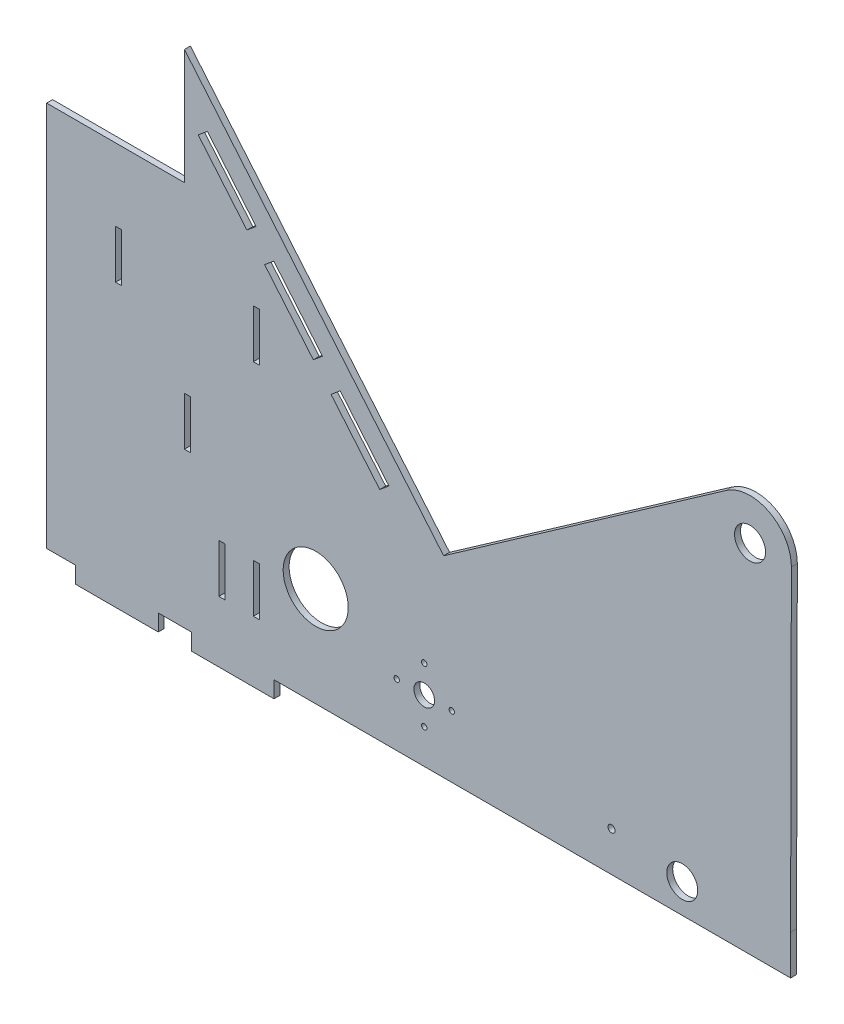
from build123d import *

# Parameters (mm, degrees)
SALIENTE_EXTRUIR1_DEPTH        = 5.5
SALIENTE_EXTRUIR2_START        = 11
SALIENTE_EXTRUIR2_DEPTH        = 5.5
CROQUIS25_R                    = 28.575
CROQUIS25_R_2                  = 14.2875
SALIENTE_EXTRUIR3_DEPTH        = 5.5
SALIENTE_EXTRUIR4_START        = 19.9
SALIENTE_EXTRUIR4_OUTLINE_R    = 2.4892
SALIENTE_EXTRUIR4_OUTLINE_R_2  = 9.525
SALIENTE_EXTRUIR4_OUTLINE_R_3  = 14.2875
SALIENTE_EXTRUIR4_DEPTH        = 5.5
CROQUIS27_R                    = 14.2875
SALIENTE_EXTRUIR6_DEPTH        = 5.5
SALIENTE_EXTRUIR6_2_DEPTH      = 5.5
CROQUIS28_W                    = 5.5
CROQUIS28_H                    = 31.75
CROQUIS28_R                    = 3.2639
CORTAR_EXTRUIR1_DEPTH          = 734.427120494
CORTAR_EXTRUIR2_START          = -25.4
CROQUIS29_W                    = 5.5
CROQUIS29_H                    = 31.75
CROQUIS29_W_2                  = 31.75
CROQUIS29_H_2                  = 5.5
CORTAR_EXTRUIR2_DEPTH          = 25.4
CROQUIS28_3_W                  = 5.5
CROQUIS28_3_H                  = 31.75
SALIENTE_EXTRUIR7_DEPTH        = 5.5
SALIENTE_EXTRUIR8_START        = -5.5
CROQUIS28_4_W                  = 5.5
CROQUIS28_4_H                  = 9.525
CROQUIS28_4_H_2                = 31.75
SALIENTE_EXTRUIR8_DEPTH        = 14.4
SALIENTE_EXTRUIR9_START        = -19.9
CROQUIS28_6_W                  = 5.5
CROQUIS28_6_H                  = 31.75
SALIENTE_EXTRUIR9_DEPTH        = 82.5
SALIENTE_EXTRUIR11_START       = -5.5
CROQUIS29_4_W                  = 5.5
CROQUIS29_4_H                  = 9.525
CROQUIS29_4_H_2                = 31.75
SALIENTE_EXTRUIR11_DEPTH       = 14.4
CROQUIS29_3_W                  = 5.5
CROQUIS29_3_H                  = 31.75
SALIENTE_EXTRUIR10_DEPTH       = 5.5
SALIENTE_EXTRUIR12_START       = -19.9
CROQUIS29_5_W                  = 5.5
CROQUIS29_5_H                  = 31.75
SALIENTE_EXTRUIR12_DEPTH       = 5.5
REDONDEO3_R                    = 6.35
REDONDEO2_R                    = 6.35
REDONDEO1_R                    = 2.54
CROQUIS30_R                    = 3.2639
CROQUIS30_W                    = 5.5
CROQUIS30_H                    = 31.75
CORTAR_EXTRUIR3_DEPTH          = 752.950892194
CROQUIS32_R                    = 14.2875
CROQUIS32_R_2                  = 30
CORTAR_EXTRUIR5_DEPTH          = 773.041576806
CROQUIS33_W                    = 127
CROQUIS33_H                    = 355.6
SALIENTE_EXTRUIR13_DEPTH       = 5.5
SALIENTE_EXTRUIR14_START       = -136.525
SALIENTE_EXTRUIR14_DEPTH       = 5.5
CROQUIS35_R                    = 2.4892
CROQUIS35_R_2                  = 9.525
CORTAR_EXTRUIR6_DEPTH          = 5.5
SALIENTE_EXTRUIR15_OUTLINE_R   = 14.2875
SALIENTE_EXTRUIR15_OUTLINE_R_2 = 2.4892
SALIENTE_EXTRUIR15_DEPTH       = 5.5
CROQUIS37_R                    = 28.575
CROQUIS37_R_2                  = 14.2875
SALIENTE_EXTRUIR16_DEPTH       = 5.5
CROQUIS48_R                    = 14.2875
SALIENTE_EXTRUIR21_DEPTH       = 5.5
CROQUIS50_R                    = 2.4892
CROQUIS50_R_2                  = 9.525
CORTAR_EXTRUIR9_DEPTH          = 5.5
SALIENTE_EXTRUIR22_START       = -196.85
CROQUIS51_R                    = 14.2875
SALIENTE_EXTRUIR22_DEPTH       = 5.5
CROQUIS57_W                    = 76.2
CROQUIS57_H                    = 15.24
SALIENTE_EXTRUIR23_DEPTH       = 5.5
SALIENTE_EXTRUIR24_START       = -60.325
CROQUIS57_3_W                  = 76.2
CROQUIS57_3_H                  = 15.24
SALIENTE_EXTRUIR24_DEPTH       = 5.5
SALIENTE_EXTRUIR25_START       = -338.875
CROQUIS57_4_W                  = 76.2
CROQUIS57_4_H                  = 15.24
SALIENTE_EXTRUIR25_DEPTH       = 5.5
SALIENTE_EXTRUIR26_START       = -404.7
CROQUIS57_5_W                  = 76.2
CROQUIS57_5_H                  = 15.24
SALIENTE_EXTRUIR26_DEPTH       = 5.5
CROQUIS58_R                    = 3.2639
CORTAR_EXTRUIR13_DEPTH         = 5.5
CROQUIS59_R                    = 14.2875
CORTAR_EXTRUIR14_DEPTH         = 808.779583764
CROQUIS61_R                    = 2.4892
CROQUIS61_R_2                  = 14.2875
CORTAR_EXTRUIR15_DEPTH         = 5.5
CORTAR_EXTRUIR16_START         = -213.35
CROQUIS62_R                    = 30
CORTAR_EXTRUIR16_DEPTH         = 153.025
CROQUIS64_R                    = 2.4892
CROQUIS64_R_2                  = 9.525
CORTAR_EXTRUIR17_DEPTH         = 5.5
CROQUIS65_R                    = 30
CORTAR_EXTRUIR18_DEPTH         = 5.5
CROQUIS66_R                    = 30
CORTAR_EXTRUIR19_DEPTH         = 5.5
CROQUIS72_R                    = 2.4892
CROQUIS72_R_2                  = 14.2875
SALIENTE_EXTRUIR27_DEPTH       = 5.5
REDONDEO4_R                    = 12.7
CROQUIS73_R                    = 14.2875
SALIENTE_EXTRUIR28_DEPTH       = 5.5
CROQUIS74_R                    = 19.05
CROQUIS74_R_2                  = 3.2639
CROQUIS74_R_3                  = 14.2875
CROQUIS74_R_4                  = 28.575
SALIENTE_EXTRUIR29_DEPTH       = 5.5
CROQUIS75_R                    = 3.2639
SALIENTE_EXTRUIR30_DEPTH       = 5.5
CROQUIS76_R                    = 3.2639
CORTAR_EXTRUIR20_DEPTH         = 808.779583764
CORTAR_EXTRUIR22_START         = -344.375
CROQUIS86_W                    = 5.5
CROQUIS86_H                    = 9.398
CROQUIS86_H_2                  = 44.704
CORTAR_EXTRUIR22_DEPTH         = 349.875
CORTAR_EXTRUIR23_START         = -190.5
CORTAR_EXTRUIR23_OUTLINE_W     = 44.704
CORTAR_EXTRUIR23_OUTLINE_H     = 5.5
CORTAR_EXTRUIR23_DEPTH         = 5.5
CORTAR_EXTRUIR23_START_2       = -317.5
CORTAR_EXTRUIR23_2_OUTLINE_W   = 44.704
CORTAR_EXTRUIR23_2_OUTLINE_H   = 5.5
CORTAR_EXTRUIR23_2_DEPTH       = 5.5
CORTAR_EXTRUIR23_START_3       = -254
CORTAR_EXTRUIR23_3_OUTLINE_W   = 44.704
CORTAR_EXTRUIR23_3_OUTLINE_H   = 5.5
CORTAR_EXTRUIR23_3_DEPTH       = 5.5
CORTAR_EXTRUIR23_START_4       = -222.25
CORTAR_EXTRUIR23_4_OUTLINE_W   = 44.704
CORTAR_EXTRUIR23_4_OUTLINE_H   = 5.5
CORTAR_EXTRUIR23_4_DEPTH       = 5.5
CORTAR_EXTRUIR24_START         = 106.172
CORTAR_EXTRUIR24_OUTLINE_W     = 5.5
CORTAR_EXTRUIR24_OUTLINE_H     = 5.5
CORTAR_EXTRUIR24_DEPTH         = 44.704
CORTAR_EXTRUIR24_START_2       = 309.372
CORTAR_EXTRUIR24_2_OUTLINE_W   = 5.5
CORTAR_EXTRUIR24_2_OUTLINE_H   = 5.5
CORTAR_EXTRUIR24_2_DEPTH       = 44.704
CORTAR_EXTRUIR24_START_3       = 207.772
CORTAR_EXTRUIR24_3_OUTLINE_W   = 5.5
CORTAR_EXTRUIR24_3_OUTLINE_H   = 5.5
CORTAR_EXTRUIR24_3_DEPTH       = 44.704


with BuildPart() as part:
    # Saliente-Extruir1: read off the stored shape, not the designer's step
    # Saliente-Extruir1 outline → Saliente-Extruir1 (new body)
    with BuildSketch(Plane.XY):
        with BuildLine():
            Line((304.8, 65.024), (304.8, 101.6))
            Line((304.8, 101.6), (305.518723438, 393.476897418))
            ThreePointArc((305.518723438, 393.476897418), (285.011345602, 427.272010162), (245.565461213, 424.686590306))
            Line((245.565461213, 424.686590306), (-15.062283685, 242.193078662))
            Line((-15.062283685, 242.193078662), (-254, 526.947960486))
            Line((-254, 526.947960486), (-254, 65.024))
            Line((-254, 65.024), (304.8, 65.024))
        make_face()
        Polygon((-118.848960355, 319.131722449), (-110.42247148, 326.202386155), (-65.523756944, 272.694181803), (-73.950245818, 265.623518097), align=None, mode=Mode.SUBTRACT)
        Polygon((-135.175765641, 338.589251304), (-180.074480177, 392.097455656), (-171.647991303, 399.168119362), (-126.749276766, 345.65991501), align=None, mode=Mode.SUBTRACT)
        Polygon((-241.3, 465.063188863), (-232.873511126, 472.133852569), (-187.974796589, 418.625648217), (-196.401285463, 411.554984511), align=None, mode=Mode.SUBTRACT)
    extrude(amount=SALIENTE_EXTRUIR1_DEPTH)

    # Croquis32 → Cortar-Extruir5 (cut, through all)
    with BuildSketch(Plane.XY):
        with Locations((267.418723438, 393.476897418)):
            Circle(CROQUIS32_R)
        with Locations((-101.257230696, 177.576897418)):
            Circle(CROQUIS32_R_2)
    extrude(amount=CORTAR_EXTRUIR5_DEPTH, mode=Mode.SUBTRACT)


with BuildPart() as body_2:
    # Croquis23 → Saliente-Extruir2 (new body)
    with BuildSketch(Plane(origin=(87.398264381, 73.335851407, 0), x_dir=(0, 0, -1), z_dir=(0.7660444431189755, 0.6427876096865426, 0)).offset(SALIENTE_EXTRUIR2_START)):
        Polygon((0, 511.363721745), (0, 530.413721745), (393.7, 530.413721745), (393.7, 511.363721745), (419.1, 511.363721745), (419.1, 441.513721745), (393.7, 441.513721745), (393.7, 416.113721745), (419.1, 416.113721745), (419.1, 346.263721745), (393.7, 346.263721745), (393.7, 320.863721745), (419.1, 320.863721745), (419.1, 251.013721745), (393.7, 251.013721745), (393.7, 231.963721745), (0, 231.963721745), (0, 251.013721745), (-25.4, 251.013721745), (-25.4, 320.863721745), (0, 320.863721745), (0, 346.263721745), (-25.4, 346.263721745), (-25.4, 416.113721745), (0, 416.113721745), (0, 441.513721745), (-25.4, 441.513721745), (-25.4, 511.363721745), align=None)
    extrude(amount=-SALIENTE_EXTRUIR2_DEPTH)


with BuildPart() as body_3:
    # Croquis25 → Saliente-Extruir3 (new body)
    # profile 1 of 3: a face of its own
    with BuildSketch(Plane(origin=(132.35549686, 111.059448599, 0), x_dir=(0, 0, -1), z_dir=(0.7660444431189746, 0.6427876096865435, 0))):
        with BuildLine():
            Line((101.933330277, 578.835507871), (-10.322085411, 580.145067799))
            ThreePointArc((-10.322085411, 580.145067799), (5.142276728, 568.625511207), (11.028255049, 550.262452103))
            ThreePointArc((11.028255049, 550.262452103), (-16.87858922, 518.890124653), (-51.288986242, 542.951285546))
            Line((-51.288986242, 542.951285546), (-58.973711334, 452.554864488))
            ThreePointArc((-58.973711334, 452.554864488), (-23.594245293, 471.109148822), (1.66840741, 440.161346591))
            ThreePointArc((1.66840741, 440.161346591), (-4.703688637, 421.136269463), (-21.249111211, 409.786989328))
            Line((-21.249111211, 409.786989328), (90.922614198, 405.25959302))
            ThreePointArc((90.922614198, 405.25959302), (63.505812198, 434.387656714), (92.075, 462.386346591))
            Line((92.075, 462.386346591), (101.6, 521.687452103))
            ThreePointArc((101.6, 521.687452103), (73.025486062, 550.429120077), (101.933330277, 578.835507871))
        make_face()
    # profile 2 of 3: a face of its own
    with BuildSketch(Plane(origin=(132.35549686, 111.059448599, 0), x_dir=(0, 0, -1), z_dir=(0.7660444431189746, 0.6427876096865435, 0))):
        with Locations((101.6, 550.262452103)):
            Circle(CROQUIS25_R)
        with Locations(Location((101.6, 550.262452103, 0), (0, 0, 90))):
            Circle(CROQUIS25_R_2, mode=Mode.SUBTRACT)
    # profile 3 of 3: a face of its own
    with BuildSketch(Plane(origin=(132.35549686, 111.059448599, 0), x_dir=(0, 0, -1), z_dir=(0.7660444431189746, 0.6427876096865435, 0))):
        with Locations((92.075, 433.811346591)):
            Circle(CROQUIS25_R)
        with Locations(Location((92.075, 433.811346591, 0), (0, 0, 90))):
            Circle(CROQUIS25_R_2, mode=Mode.SUBTRACT)
    extrude(amount=SALIENTE_EXTRUIR3_DEPTH)


with BuildPart() as body_4:
    # Saliente-Extruir4: read off the stored shape, not the designer's step
    # Saliente-Extruir4 outline → Saliente-Extruir4 (new body)
    with BuildSketch(Plane(origin=(132.35549686, 111.059448599, 0), x_dir=(0, 0, -1), z_dir=(0.7660444431189746, 0.6427876096865435, 0)).offset(SALIENTE_EXTRUIR4_START)):
        with BuildLine():
            Line((101.933330277, 578.835507871), (-20.209291903, 580.260410915))
            ThreePointArc((-20.209291903, 580.260410915), (-40.724921947, 572.473833674), (-50.451424968, 552.803627773))
            Line((-50.451424968, 552.803627773), (-59.811272608, 442.702522261))
            ThreePointArc((-59.811272608, 442.702522261), (-52.417297189, 420.316176149), (-31.12894645, 410.185752291))
            Line((-31.12894645, 410.185752291), (90.922614198, 405.25959302))
            ThreePointArc((90.922614198, 405.25959302), (120.644187802, 433.235036468), (92.075, 462.386346591))
            Line((92.075, 462.386346591), (101.6, 521.687452103))
            ThreePointArc((101.6, 521.687452103), (130.174513938, 550.095784129), (101.933330277, 578.835507871))
        make_face()
        with Locations((-29.91909259, 414.761346591)):
            Circle(SALIENTE_EXTRUIR4_OUTLINE_R, mode=Mode.SUBTRACT)
        with Locations((-55.31909259, 440.161346591)):
            Circle(SALIENTE_EXTRUIR4_OUTLINE_R, mode=Mode.SUBTRACT)
        with Locations((-29.91909259, 440.161346591)):
            Circle(SALIENTE_EXTRUIR4_OUTLINE_R_2, mode=Mode.SUBTRACT)
        with Locations((-4.51909259, 440.161346591)):
            Circle(SALIENTE_EXTRUIR4_OUTLINE_R, mode=Mode.SUBTRACT)
        with Locations((-29.91909259, 465.561346591)):
            Circle(SALIENTE_EXTRUIR4_OUTLINE_R, mode=Mode.SUBTRACT)
        with Locations((92.075, 433.811346591)):
            Circle(SALIENTE_EXTRUIR4_OUTLINE_R_3, mode=Mode.SUBTRACT)
        with Locations((-20.559244951, 524.862452103)):
            Circle(SALIENTE_EXTRUIR4_OUTLINE_R, mode=Mode.SUBTRACT)
        with Locations((-45.959244951, 550.262452103)):
            Circle(SALIENTE_EXTRUIR4_OUTLINE_R, mode=Mode.SUBTRACT)
        with Locations((-20.559244951, 550.262452103)):
            Circle(SALIENTE_EXTRUIR4_OUTLINE_R_2, mode=Mode.SUBTRACT)
        with Locations((-20.559244951, 575.662452103)):
            Circle(SALIENTE_EXTRUIR4_OUTLINE_R, mode=Mode.SUBTRACT)
        with Locations((4.840755049, 550.262452103)):
            Circle(SALIENTE_EXTRUIR4_OUTLINE_R, mode=Mode.SUBTRACT)
        with Locations((101.6, 550.262452103)):
            Circle(SALIENTE_EXTRUIR4_OUTLINE_R_3, mode=Mode.SUBTRACT)
    extrude(amount=SALIENTE_EXTRUIR4_DEPTH)


with BuildPart() as body_5:
    # Croquis27 → Saliente-Extruir6 (new body)
    with BuildSketch(Plane(origin=(132.35549686, 111.059448599, 0), x_dir=(0, 0, -1), z_dir=(0.7660444431189746, 0.6427876096865435, 0))):
        with Locations(Location((101.6, 550.262452103, 0), (0, 0, 90))):
            Circle(CROQUIS27_R)
    extrude(amount=-SALIENTE_EXTRUIR6_DEPTH)


with BuildPart() as body_6:
    # Croquis27 → Saliente-Extruir6 2 (new body)
    with BuildSketch(Plane(origin=(132.35549686, 111.059448599, 0), x_dir=(0, 0, -1), z_dir=(0.7660444431189746, 0.6427876096865435, 0))):
        with BuildLine():
            Line((0, 408.929347642), (40.009520745, 407.314511499))
            ThreePointArc((40.009520745, 407.314511499), (37.908230374, 455.694158756), (73.025, 489.03809645))
            Line((73.025, 489.03809645), (73.025, 499.307905937))
            ThreePointArc((73.025, 499.307905937), (45.272775072, 534.765996642), (50.982251039, 579.429897827))
            Line((50.982251039, 579.429897827), (0.067433873, 580.023864754))
            Line((0.067433873, 580.023864754), (0, 574.243436305))
            ThreePointArc((0, 574.243436305), (11.028255049, 550.262452103), (0, 526.281467901))
            Line((0, 526.281467901), (0, 450.291403591))
            ThreePointArc((0, 450.291403591), (1.66840741, 440.161346591), (0, 430.03128959))
            Line((0, 430.03128959), (0, 408.929347642))
        make_face()
    extrude(amount=-SALIENTE_EXTRUIR6_2_DEPTH)


with BuildPart() as cortar_extruir1_tool:
    # Croquis28 → Cortar-Extruir1 (new, through all)
    with BuildSketch(Plane(origin=(151.813025715, 127.386253885, 0), x_dir=(0, 0, -1), z_dir=(0.7660444431189746, 0.6427876096865435, 0))):
        with Locations((26.478255049, 548.148001193)):
            Rectangle(CROQUIS28_W, CROQUIS28_H)
        with Locations((12.275, 494.173001193)):
            Rectangle(CROQUIS28_W, CROQUIS28_H)
        with Locations((36.825, 494.173001193)):
            Rectangle(CROQUIS28_W, CROQUIS28_H)
        with Locations(Location((23.728255049, 494.173001193, 0), (0, 0, 90))):
            Circle(CROQUIS28_R)
        with Locations(Location((57.0611, 494.173001193, 0), (0, 0, 90))):
            Circle(CROQUIS28_R)
        with Locations((19.3625, 440.198001193)):
            Rectangle(CROQUIS28_W, CROQUIS28_H)
    extrude(amount=-CORTAR_EXTRUIR1_DEPTH)


with BuildPart() as body_2_1:
    add(body_2.part)

    # Cortar-Extruir1: cut by cortar_extruir1_tool
    add(cortar_extruir1_tool.part, mode=Mode.SUBTRACT)


with BuildPart() as body_3_1:
    add(body_3.part)

    # Cortar-Extruir1: cut by cortar_extruir1_tool
    add(cortar_extruir1_tool.part, mode=Mode.SUBTRACT)


with BuildPart() as body_4_1:
    add(body_4.part)

    # Cortar-Extruir1: cut by cortar_extruir1_tool
    add(cortar_extruir1_tool.part, mode=Mode.SUBTRACT)


with BuildPart() as body_6_1:
    add(body_6.part)

    # Cortar-Extruir1: cut by cortar_extruir1_tool
    add(cortar_extruir1_tool.part, mode=Mode.SUBTRACT)


with BuildPart() as cortar_extruir2_tool:
    # Croquis29 → Cortar-Extruir2 (new body)
    with BuildSketch(Plane(origin=(151.813025715, 127.386253885, 0), x_dir=(0, 0, -1), z_dir=(0.7660444431189746, 0.6427876096865435, 0)).offset(CORTAR_EXTRUIR2_START)):
        with Locations((-42.97, 496.922452103)):
            Rectangle(CROQUIS29_W, CROQUIS29_H)
        with Locations((50.6875, 415.223001193)):
            Rectangle(CROQUIS29_W_2, CROQUIS29_H_2)
        with Locations((66.9875, 449.723001193)):
            Rectangle(CROQUIS29_W, CROQUIS29_H)
        with Locations((59.078255049, 533.123001193)):
            Rectangle(CROQUIS29_W, CROQUIS29_H)
        with Locations((80.453255049, 533.123001193)):
            Rectangle(CROQUIS29_W, CROQUIS29_H)
        with Locations((60.978255049, 570.798001193)):
            Rectangle(CROQUIS29_W_2, CROQUIS29_H_2)
    extrude(amount=CORTAR_EXTRUIR2_DEPTH)


with BuildPart() as body_3_2:
    add(body_3_1.part)

    # Cortar-Extruir2: cut by cortar_extruir2_tool
    add(cortar_extruir2_tool.part, mode=Mode.SUBTRACT)

    # Redondeo3
    redondeo3_edges = [body_3_2.edges().sort_by_distance(p)[0] for p in [
        (-200.872111263, 512.462888254, -101.6),
        (-162.754095399, 467.035605906, -92.075),
    ]]
    fillet(redondeo3_edges, radius=REDONDEO3_R)

    # Redondeo1
    redondeo1_edges = [body_3_2.edges().sort_by_distance(p)[0] for p in [
        (-156.434540518, 459.504253673, 58.973711334),
        (-214.540239934, 528.751929702, 51.288986242),
        (-238.447942324, 557.244019916, 10.322085411),
        (-128.943880273, 426.742160563, 21.249111211),
    ]]
    fillet(redondeo1_edges, radius=REDONDEO1_R)


with BuildPart() as body_4_2:
    add(body_4_1.part)

    # Cortar-Extruir2: cut by cortar_extruir2_tool
    add(cortar_extruir2_tool.part, mode=Mode.SUBTRACT)

    # Redondeo2
    redondeo2_edges = [body_4_2.edges().sort_by_distance(p)[0] for p in [
        (-185.627826845, 525.254361687, -101.6),
        (-147.509810981, 479.827079339, -92.075),
    ]]
    fillet(redondeo2_edges, radius=REDONDEO2_R)


with BuildPart() as body_7:
    # Croquis28<3> → Saliente-Extruir7 (new body)
    with BuildSketch(Plane(origin=(151.813025715, 127.386253885, 0), x_dir=(0, 0, -1), z_dir=(0.7660444431189746, 0.6427876096865435, 0))):
        with Locations((26.478255049, 548.148001193)):
            Rectangle(CROQUIS28_3_W, CROQUIS28_3_H)
    extrude(amount=-SALIENTE_EXTRUIR7_DEPTH)


with BuildPart() as body_8:
    # Croquis28<4> → Saliente-Extruir8 (new body)
    with BuildSketch(Plane(origin=(151.813025715, 127.386253885, 0), x_dir=(0, 0, -1), z_dir=(0.7660444431189746, 0.6427876096865435, 0)).offset(SALIENTE_EXTRUIR8_START)):
        with Locations((26.478255049, 568.785501193)):
            Rectangle(CROQUIS28_4_W, CROQUIS28_4_H)
        with Locations((26.478255049, 548.148001193)):
            Rectangle(CROQUIS28_4_W, CROQUIS28_4_H_2)
        with Locations((26.478255049, 527.510501193)):
            Rectangle(CROQUIS28_4_W, CROQUIS28_4_H)
    extrude(amount=-SALIENTE_EXTRUIR8_DEPTH)


with BuildPart() as body_9:
    # Croquis28<6> → Saliente-Extruir9 (new body)
    with BuildSketch(Plane(origin=(151.813025715, 127.386253885, 0), x_dir=(0, 0, -1), z_dir=(0.7660444431189746, 0.6427876096865435, 0)).offset(SALIENTE_EXTRUIR9_START)):
        with Locations((26.478255049, 548.148001193)):
            Rectangle(CROQUIS28_6_W, CROQUIS28_6_H)
    extrude(amount=-SALIENTE_EXTRUIR9_DEPTH)

    # Combinar1: union body 8, body 7
    add(body_8.part)
    add(body_7.part)


with BuildPart() as body_8_2:
    # Croquis29<4> → Saliente-Extruir11 (new body)
    with BuildSketch(Plane(origin=(151.813025715, 127.386253885, 0), x_dir=(0, 0, -1), z_dir=(0.7660444431189746, 0.6427876096865435, 0)).offset(SALIENTE_EXTRUIR11_START)):
        with Locations((-42.97, 517.559952103)):
            Rectangle(CROQUIS29_4_W, CROQUIS29_4_H)
        with Locations((-42.97, 496.922452103)):
            Rectangle(CROQUIS29_4_W, CROQUIS29_4_H_2)
        with Locations((-42.97, 476.284952103)):
            Rectangle(CROQUIS29_4_W, CROQUIS29_4_H)
    extrude(amount=-SALIENTE_EXTRUIR11_DEPTH)


with BuildPart() as body_9_2:
    # Croquis29<3> → Saliente-Extruir10 (new body)
    with BuildSketch(Plane(origin=(151.813025715, 127.386253885, 0), x_dir=(0, 0, -1), z_dir=(0.7660444431189746, 0.6427876096865435, 0))):
        with Locations((-42.97, 496.922452103)):
            Rectangle(CROQUIS29_3_W, CROQUIS29_3_H)
    extrude(amount=-SALIENTE_EXTRUIR10_DEPTH)


with BuildPart() as body_10:
    # Croquis29<5> → Saliente-Extruir12 (new body)
    with BuildSketch(Plane(origin=(151.813025715, 127.386253885, 0), x_dir=(0, 0, -1), z_dir=(0.7660444431189746, 0.6427876096865435, 0)).offset(SALIENTE_EXTRUIR12_START)):
        with Locations((-42.97, 496.922452103)):
            Rectangle(CROQUIS29_5_W, CROQUIS29_5_H)
    extrude(amount=-SALIENTE_EXTRUIR12_DEPTH)


with BuildPart() as body_9_2_1:
    add(body_9_2.part)

    # Combinar2: union body 8 2, body 10
    add(body_8_2.part)
    add(body_10.part)


with BuildPart() as cortar_extruir3_tool:
    # Croquis30 → Cortar-Extruir3 (new, through all)
    with BuildSketch(Plane(origin=(95.824753255, 80.406515114, 0), x_dir=(0, 0, -1), z_dir=(0.7660444431189746, 0.6427876096865435, 0))):
        with Locations(Location((57.0611, 494.173001193, 0), (0, 0, 90))):
            Circle(CROQUIS30_R)
        with Locations(Location((23.728255049, 494.173001193, 0), (0, 0, 90))):
            Circle(CROQUIS30_R)
        with Locations(Location((369.971744951, 494.173001193, 0), (0, 0, 90))):
            Circle(CROQUIS30_R)
        with Locations(Location((336.6389, 494.173001193, 0), (0, 0, 90))):
            Circle(CROQUIS30_R)
        with Locations((26.478255049, 548.148001193)):
            Rectangle(CROQUIS30_W, CROQUIS30_H)
        with Locations((19.3625, 440.198001193)):
            Rectangle(CROQUIS30_W, CROQUIS30_H)
        with Locations((36.825, 494.173001193)):
            Rectangle(CROQUIS30_W, CROQUIS30_H)
        with Locations((12.275, 494.173001193)):
            Rectangle(CROQUIS30_W, CROQUIS30_H)
        with Locations((381.425, 494.173001193)):
            Rectangle(CROQUIS30_W, CROQUIS30_H)
        with Locations((356.875, 494.173001193)):
            Rectangle(CROQUIS30_W, CROQUIS30_H)
        with Locations((374.3375, 440.198001193)):
            Rectangle(CROQUIS30_W, CROQUIS30_H)
        with Locations((367.221744951, 548.148001193)):
            Rectangle(CROQUIS30_W, CROQUIS30_H)
    extrude(amount=-CORTAR_EXTRUIR3_DEPTH)


with BuildPart() as body_2_2:
    add(body_2_1.part)

    # Cortar-Extruir3: cut by cortar_extruir3_tool
    add(cortar_extruir3_tool.part, mode=Mode.SUBTRACT)


with BuildPart() as body_9_1:
    add(body_9.part)

    # Cortar-Extruir3: cut by cortar_extruir3_tool
    add(cortar_extruir3_tool.part, mode=Mode.SUBTRACT)


with BuildPart() as body_9_3:
    # Croquis33 → Saliente-Extruir13 (new body)
    with BuildSketch(Plane.XY.offset(5.5)):
        with Locations((-317.5, 242.824)):
            Rectangle(CROQUIS33_W, CROQUIS33_H)
    extrude(amount=-SALIENTE_EXTRUIR13_DEPTH)

    # Combinar3: union part
    add(part.part)

    # Croquis57 → Saliente-Extruir23 (add)
    with BuildSketch(Plane.XY.offset(5.5)):
        with Locations((-209.55, 57.404)):
            Rectangle(CROQUIS57_W, CROQUIS57_H)
        with Locations((-316.23, 57.404)):
            Rectangle(CROQUIS57_W, CROQUIS57_H)
    extrude(amount=-SALIENTE_EXTRUIR23_DEPTH)


with BuildPart() as body_9_4:
    # Croquis34 → Saliente-Extruir14 (new body)
    with BuildSketch(Plane(origin=(0, 0, -196.85), x_dir=(-1, 0, 0), z_dir=(0, 0, -1)).offset(SALIENTE_EXTRUIR14_START)):
        Polygon((254, 420.624), (204.011093016, 420.624), (45.673607614, 231.92473293), (7.573607614, 231.92473293), (-304.8, 95.599045569), (-304.8, 65.024), (381, 65.024), (381, 420.624), align=None)
    extrude(amount=-SALIENTE_EXTRUIR14_DEPTH)


with BuildPart() as body_10_2:
    # Simetría2: mirrored copy
    add(body_9_4.part.mirror(Plane(origin=(0, 0, -196.85), x_dir=(1, 0, 0), z_dir=(0, 0, -1))))

    # Croquis50 → Cortar-Extruir9 (cut)
    with BuildSketch(Plane(origin=(0, 0, -338.875), x_dir=(-1, 0, 0), z_dir=(0, 0, -1))):
        with Locations(Location((133.007230696, 182.266805062, 0), (0, 0, 90))):
            Circle(CROQUIS50_R)
        with Locations(Location((107.607230696, 156.866805062, 0), (0, 0, 90))):
            Circle(CROQUIS50_R)
        with Locations(Location((133.007230696, 131.466805062, 0), (0, 0, 90))):
            Circle(CROQUIS50_R)
        with Locations(Location((158.407230696, 156.866805062, 0), (0, 0, 90))):
            Circle(CROQUIS50_R)
        with Locations(Location((133.007230696, 156.866805062, 0), (0, 0, 90))):
            Circle(CROQUIS50_R_2)
    extrude(amount=-CORTAR_EXTRUIR9_DEPTH, mode=Mode.SUBTRACT)

    # Croquis57<4> → Saliente-Extruir25 (add)
    with BuildSketch(Plane.XY.offset(5.5).offset(SALIENTE_EXTRUIR25_START)):
        with Locations((196.85, 57.404)):
            Rectangle(CROQUIS57_4_W, CROQUIS57_4_H)
        with Locations((95.25, 57.404)):
            Rectangle(CROQUIS57_4_W, CROQUIS57_4_H)
        with Locations((-209.55, 57.404)):
            Rectangle(CROQUIS57_4_W, CROQUIS57_4_H)
        with Locations((-316.23, 57.404)):
            Rectangle(CROQUIS57_4_W, CROQUIS57_4_H)
    extrude(amount=-SALIENTE_EXTRUIR25_DEPTH)


with BuildPart() as body_9_4_1:
    add(body_9_4.part)

    # Croquis35 → Cortar-Extruir6 (cut)
    with BuildSketch(Plane(origin=(0, 0, -60.325), x_dir=(-1, 0, 0), z_dir=(0, 0, -1))):
        with Locations(Location((101.257230696, 152.176897418, 0), (0, 0, 90))):
            Circle(CROQUIS35_R)
        with Locations(Location((126.657230696, 177.576897418, 0), (0, 0, 90))):
            Circle(CROQUIS35_R)
        with Locations(Location((75.857230696, 177.576897418, 0), (0, 0, 90))):
            Circle(CROQUIS35_R)
        with Locations(Location((101.257230696, 202.976897418, 0), (0, 0, 90))):
            Circle(CROQUIS35_R)
        with Locations(Location((101.257230696, 177.576897418, 0), (0, 0, 90))):
            Circle(CROQUIS35_R_2)
    extrude(amount=-CORTAR_EXTRUIR6_DEPTH, mode=Mode.SUBTRACT)

    # Croquis57<3> → Saliente-Extruir24 (add)
    with BuildSketch(Plane.XY.offset(5.5).offset(SALIENTE_EXTRUIR24_START)):
        with Locations((196.85, 57.404)):
            Rectangle(CROQUIS57_3_W, CROQUIS57_3_H)
        with Locations((95.25, 57.404)):
            Rectangle(CROQUIS57_3_W, CROQUIS57_3_H)
        with Locations((-209.55, 57.404)):
            Rectangle(CROQUIS57_3_W, CROQUIS57_3_H)
        with Locations((-316.23, 57.404)):
            Rectangle(CROQUIS57_3_W, CROQUIS57_3_H)
    extrude(amount=-SALIENTE_EXTRUIR24_DEPTH)


with BuildPart() as body_11:
    # Saliente-Extruir15: read off the stored shape, not the designer's step
    # Saliente-Extruir15 outline → Saliente-Extruir15 (new body)
    with BuildSketch(Plane(origin=(0, 0, -196.85), x_dir=(-1, 0, 0), z_dir=(0, 0, -1))):
        with BuildLine():
            ThreePointArc((-241.008526946, 429.230275178), (-304.77195089, 417.571272257), (-289.10066329, 354.673598793))
            Line((-289.10066329, 354.673598793), (-70.578187003, 232.570804569))
            ThreePointArc((-70.578187003, 232.570804569), (-32.627008021, 242.026541289), (-39.661813638, 280.500096531))
            Line((-39.661813638, 280.500096531), (-241.008526946, 429.230275178))
        make_face()
        with Locations((-56.639797097, 257.515782257)):
            Circle(SALIENTE_EXTRUIR15_OUTLINE_R, mode=Mode.SUBTRACT)
        with Locations((-267.418723438, 364.901897418)):
            Circle(SALIENTE_EXTRUIR15_OUTLINE_R_2, mode=Mode.SUBTRACT)
        with Locations((-295.993723438, 393.476897418)):
            Circle(SALIENTE_EXTRUIR15_OUTLINE_R_2, mode=Mode.SUBTRACT)
        with Locations((-267.418723438, 393.476897418)):
            Circle(SALIENTE_EXTRUIR15_OUTLINE_R, mode=Mode.SUBTRACT)
        with Locations((-267.418723438, 422.051897418)):
            Circle(SALIENTE_EXTRUIR15_OUTLINE_R_2, mode=Mode.SUBTRACT)
        with Locations((-238.843723438, 393.476897418)):
            Circle(SALIENTE_EXTRUIR15_OUTLINE_R_2, mode=Mode.SUBTRACT)
    extrude(amount=SALIENTE_EXTRUIR15_DEPTH)


with BuildPart() as body_12:
    # Croquis37 → Saliente-Extruir16 (new body)
    # profile 1 of 3: a face of its own
    with BuildSketch(Plane(origin=(0, 0, -196.85), x_dir=(-1, 0, 0), z_dir=(0, 0, -1))):
        with BuildLine():
            Line((-41.15055613, 281.528571334), (-251.92948247, 417.489686495))
            ThreePointArc((-251.92948247, 417.489686495), (-242.327532895, 407.150330863), (-238.843723438, 393.476897418))
            ThreePointArc((-238.843723438, 393.476897418), (-253.745289993, 368.385706876), (-282.907964405, 369.464108342))
            Line((-282.907964405, 369.464108342), (-72.129038065, 233.50299318))
            ThreePointArc((-72.129038065, 233.50299318), (-80.652586174, 273.005023225), (-41.15055613, 281.528571334))
        make_face()
    # profile 2 of 3: a face of its own
    with BuildSketch(Plane(origin=(0, 0, -196.85), x_dir=(-1, 0, 0), z_dir=(0, 0, -1))):
        with Locations((-267.418723438, 393.476897418)):
            Circle(CROQUIS37_R)
        with Locations(Location((-267.418723438, 393.476897418, 0), (0, 0, 180))):
            Circle(CROQUIS37_R_2, mode=Mode.SUBTRACT)
    # profile 3 of 3: a face of its own
    with BuildSketch(Plane(origin=(0, 0, -196.85), x_dir=(-1, 0, 0), z_dir=(0, 0, -1))):
        with Locations((-56.639797097, 257.515782257)):
            Circle(CROQUIS37_R)
        with Locations((-56.639797097, 257.515782257)):
            Circle(CROQUIS37_R_2, mode=Mode.SUBTRACT)
    extrude(amount=-SALIENTE_EXTRUIR16_DEPTH)


with BuildPart() as body_13:
    # Croquis48 → Saliente-Extruir21 (new body)
    with BuildSketch(Plane(origin=(0, 0, -393.7), x_dir=(-1, 0, 0), z_dir=(0, 0, -1))):
        with BuildLine():
            Line((254, 526.947960486), (15.062283685, 242.193078662))
            Line((15.062283685, 242.193078662), (-245.565461213, 424.686590306))
            ThreePointArc((-245.565461213, 424.686590306), (-285.011345602, 427.272010162), (-305.518723438, 393.476897418))
            Line((-305.518723438, 393.476897418), (-304.8, 101.6))
            Line((-304.8, 101.6), (-304.8, 65.024))
            Line((-304.8, 65.024), (381, 65.024))
            Line((381, 65.024), (381, 420.624))
            Line((381, 420.624), (254, 420.624))
            Line((254, 420.624), (254, 526.947960486))
        make_face()
        Polygon((180.074480177, 392.097455656), (135.175765641, 338.589251304), (126.749276766, 345.65991501), (171.647991303, 399.168119362), align=None, mode=Mode.SUBTRACT)
        Polygon((196.401285463, 411.554984511), (187.974796589, 418.625648217), (232.873511126, 472.133852569), (241.3, 465.063188863), align=None, mode=Mode.SUBTRACT)
        Polygon((118.848960355, 319.131722449), (73.950245818, 265.623518097), (65.523756944, 272.694181803), (110.42247148, 326.202386155), align=None, mode=Mode.SUBTRACT)
        with Locations((-267.418723438, 393.476897418)):
            Circle(CROQUIS48_R, mode=Mode.SUBTRACT)
    extrude(amount=SALIENTE_EXTRUIR21_DEPTH)

    # Croquis57<5> → Saliente-Extruir26 (add)
    with BuildSketch(Plane.XY.offset(5.5).offset(SALIENTE_EXTRUIR26_START)):
        with Locations((-209.55, 57.404)):
            Rectangle(CROQUIS57_5_W, CROQUIS57_5_H)
        with Locations((-316.23, 57.404)):
            Rectangle(CROQUIS57_5_W, CROQUIS57_5_H)
    extrude(amount=SALIENTE_EXTRUIR26_DEPTH)

    # Croquis58 → Cortar-Extruir13 (cut)
    with BuildSketch(Plane.XY.offset(-393.7)):
        with Locations((204.927571127, 92.075)):
            Circle(CROQUIS58_R)
    extrude(amount=-CORTAR_EXTRUIR13_DEPTH, mode=Mode.SUBTRACT)


with BuildPart() as body_14:
    # Croquis51 → Saliente-Extruir22 (new body)
    with BuildSketch(Plane(origin=(0, 0, -399.2), x_dir=(-1, 0, 0), z_dir=(0, 0, -1)).offset(SALIENTE_EXTRUIR22_START)):
        with BuildLine():
            Line((-251.92948247, 417.489686495), (-41.15055613, 281.528571334))
            ThreePointArc((-41.15055613, 281.528571334), (-32.627008021, 242.026541289), (-72.129038065, 233.50299318))
            Line((-72.129038065, 233.50299318), (-282.907964405, 369.464108342))
            ThreePointArc((-282.907964405, 369.464108342), (-291.431512514, 408.966138386), (-251.92948247, 417.489686495))
        make_face()
        with Locations((-267.418723438, 393.476897418)):
            Circle(CROQUIS51_R, mode=Mode.SUBTRACT)
        with Locations(Location((-56.639797097, 257.515782257, 0), (0, 0, 90))):
            Circle(CROQUIS51_R, mode=Mode.SUBTRACT)
    extrude(amount=SALIENTE_EXTRUIR22_DEPTH)


with BuildPart() as cortar_extruir14_tool:
    # Croquis59 → Cortar-Extruir14 (new, through all)
    with BuildSketch(Plane.XY.offset(5.5)):
        with Locations(Location((204.927571127, 92.075, 0), (0, 0, 180))):
            Circle(CROQUIS59_R)
    extrude(amount=-CORTAR_EXTRUIR14_DEPTH)


with BuildPart() as body_9_3_1:
    add(body_9_3.part)

    # Cortar-Extruir14: cut by cortar_extruir14_tool
    add(cortar_extruir14_tool.part, mode=Mode.SUBTRACT)

    # Croquis61 → Cortar-Extruir15 (cut)
    with BuildSketch(Plane.XY.offset(5.5)):
        with Locations(Location((-1.993678645, 172.974, 0), (0, 0, 180))):
            Circle(CROQUIS61_R)
        with Locations(Location((-27.393678645, 147.574, 0), (0, 0, 180))):
            Circle(CROQUIS61_R)
        with Locations(Location((-1.993678645, 122.174, 0), (0, 0, 180))):
            Circle(CROQUIS61_R)
        with Locations(Location((23.406321355, 147.574, 0), (0, 0, 180))):
            Circle(CROQUIS61_R)
        with Locations(Location((-1.993678645, 147.574, 0), (0, 0, 180))):
            Circle(CROQUIS61_R_2)
    extrude(amount=-CORTAR_EXTRUIR15_DEPTH, mode=Mode.SUBTRACT)


with BuildPart() as body_9_4_2:
    add(body_9_4_1.part)

    # Cortar-Extruir14: cut by cortar_extruir14_tool
    add(cortar_extruir14_tool.part, mode=Mode.SUBTRACT)

    # Croquis62 → Cortar-Extruir16 (cut)
    with BuildSketch(Plane.XY.offset(5.5).offset(CORTAR_EXTRUIR16_START)):
        with Locations(Location((-1.993678645, 147.574, 0), (0, 0, 90))):
            Circle(CROQUIS62_R)
    extrude(amount=CORTAR_EXTRUIR16_DEPTH, mode=Mode.SUBTRACT)


with BuildPart() as body_10_2_1:
    add(body_10_2.part)

    # Cortar-Extruir14: cut by cortar_extruir14_tool
    add(cortar_extruir14_tool.part, mode=Mode.SUBTRACT)

    # Croquis65 → Cortar-Extruir18 (cut)
    with BuildSketch(Plane(origin=(0, 0, -338.875), x_dir=(-1, 0, 0), z_dir=(0, 0, -1))):
        with Locations(Location((32.914328421, 122.174, 0), (0, 0, 90))):
            Circle(CROQUIS65_R)
    extrude(amount=-CORTAR_EXTRUIR18_DEPTH, mode=Mode.SUBTRACT)


with BuildPart() as body_13_1:
    add(body_13.part)

    # Cortar-Extruir14: cut by cortar_extruir14_tool
    add(cortar_extruir14_tool.part, mode=Mode.SUBTRACT)

    # Croquis64 → Cortar-Extruir17 (cut)
    with BuildSketch(Plane(origin=(0, 0, -399.2), x_dir=(-1, 0, 0), z_dir=(0, 0, -1))):
        with Locations((32.914328421, 147.574)):
            Circle(CROQUIS64_R)
        with Locations((58.314328421, 122.174)):
            Circle(CROQUIS64_R)
        with Locations((32.914328421, 96.774)):
            Circle(CROQUIS64_R)
        with Locations((7.514328421, 122.174)):
            Circle(CROQUIS64_R)
        with Locations((32.914328421, 122.174)):
            Circle(CROQUIS64_R_2)
    extrude(amount=-CORTAR_EXTRUIR17_DEPTH, mode=Mode.SUBTRACT)

    # Croquis66 → Cortar-Extruir19 (cut)
    with BuildSketch(Plane(origin=(0, 0, -399.2), x_dir=(-1, 0, 0), z_dir=(0, 0, -1))):
        with Locations((133.007230696, 156.866805062)):
            Circle(CROQUIS66_R)
    extrude(amount=-CORTAR_EXTRUIR19_DEPTH, mode=Mode.SUBTRACT)


with BuildPart() as body_15:
    # Croquis72 → Saliente-Extruir27 (new body)
    # profile 1 of 7: a face of its own
    with BuildSketch(Plane(origin=(0, 0, 0), x_dir=(-1, 0, 0), z_dir=(0, 0, -1))):
        with BuildLine():
            ThreePointArc((-161.747571127, 92.075), (-162.08445118, 97.458258604), (-163.089834823, 102.757519411))
            ThreePointArc((-163.089834823, 102.757519411), (-180.630649473, 127.770545914), (-210.33393971, 134.915209835))
            ThreePointArc((-210.33393971, 134.915209835), (-244.960944852, 108.256513778), (-238.584008832, 65.024))
            Line((-238.584008832, 65.024), (-206.895702383, 65.024))
            ThreePointArc((-206.895702383, 65.024), (-204.927571127, 65.9892), (-202.959439871, 65.024))
            Line((-202.959439871, 65.024), (-171.271133422, 65.024))
            ThreePointArc((-171.271133422, 65.024), (-164.197991089, 77.735763272), (-161.747571127, 92.075))
        make_face()
        with Locations((-233.502571127, 92.075)):
            Circle(CROQUIS72_R, mode=Mode.SUBTRACT)
        with Locations((-204.927571127, 92.075)):
            Circle(CROQUIS72_R_2, mode=Mode.SUBTRACT)
        with Locations((-176.352571127, 92.075)):
            Circle(CROQUIS72_R, mode=Mode.SUBTRACT)
        with Locations((-204.927571127, 120.65)):
            Circle(CROQUIS72_R, mode=Mode.SUBTRACT)
    # profile 2 of 7: a face of its own
    with BuildSketch(Plane(origin=(0, 0, 0), x_dir=(-1, 0, 0), z_dir=(0, 0, -1))):
        with BuildLine():
            ThreePointArc((-238.584008832, 65.024), (-204.927571127, 48.895), (-171.271133422, 65.024))
            Line((-171.271133422, 65.024), (-202.959439871, 65.024))
            ThreePointArc((-202.959439871, 65.024), (-202.572237927, 64.305308735), (-202.438371127, 63.5))
            ThreePointArc((-202.438371127, 63.5), (-205.732879862, 61.1446668), (-206.895702383, 65.024))
            Line((-206.895702383, 65.024), (-238.584008832, 65.024))
        make_face()
    # profile 3 of 7: a face of its own
    with BuildSketch(Plane(origin=(0, 0, 0), x_dir=(-1, 0, 0), z_dir=(0, 0, -1))):
        with BuildLine():
            Line((-163.089834823, 102.757519411), (-41.311659979, 281.666538974))
            Line((-41.311659979, 281.666538974), (-46.721026459, 285.45421816))
            ThreePointArc((-46.721026459, 285.45421816), (-70.99462024, 289.512904389), (-83.110595763, 310.9344689))
            Line((-83.110595763, 310.9344689), (-88.130296597, 314.449301263))
            Line((-88.130296597, 314.449301263), (-210.33393971, 134.915209835))
            ThreePointArc((-210.33393971, 134.915209835), (-180.630649473, 127.770545914), (-163.089834823, 102.757519411))
        make_face()
    # profile 4 of 7: a face of its own
    with BuildSketch(Plane(origin=(0, 0, 0), x_dir=(-1, 0, 0), z_dir=(0, 0, -1))):
        with BuildLine():
            ThreePointArc((-46.721026459, 285.45421816), (-37.854484063, 289.769325767), (-30.982621128, 296.841328842))
            ThreePointArc((-30.982621128, 296.841328842), (-27.295968241, 304.507966365), (-26.029673571, 312.920174055))
            ThreePointArc((-26.029673571, 312.920174055), (-46.192465881, 340.228879384), (-78.226726015, 328.999019267))
            ThreePointArc((-78.226726015, 328.999019267), (-82.189332893, 320.37786774), (-83.110595763, 310.9344689))
            Line((-83.110595763, 310.9344689), (-46.721026459, 285.45421816))
        make_face()
        with Locations((-54.604673571, 312.920174055)):
            Circle(CROQUIS72_R_2, mode=Mode.SUBTRACT)
    # profile 5 of 7: a face of its own
    with BuildSketch(Plane(origin=(0, 0, 0), x_dir=(-1, 0, 0), z_dir=(0, 0, -1))):
        with BuildLine():
            ThreePointArc((-83.110595763, 310.9344689), (-70.99462024, 289.512904389), (-46.721026459, 285.45421816))
            Line((-46.721026459, 285.45421816), (-83.110595763, 310.9344689))
        make_face()
    # profile 6 of 7: a face of its own
    with BuildSketch(Plane(origin=(0, 0, 0), x_dir=(-1, 0, 0), z_dir=(0, 0, -1))):
        with BuildLine():
            Line((-41.311659979, 281.666538974), (-30.982621128, 296.841328842))
            ThreePointArc((-30.982621128, 296.841328842), (-37.854484063, 289.769325767), (-46.721026459, 285.45421816))
            Line((-46.721026459, 285.45421816), (-41.311659979, 281.666538974))
        make_face()
    # profile 7 of 7: a face of its own
    with BuildSketch(Plane(origin=(0, 0, 0), x_dir=(-1, 0, 0), z_dir=(0, 0, -1))):
        with BuildLine():
            ThreePointArc((-83.110595763, 310.9344689), (-82.189332893, 320.37786774), (-78.226726015, 328.999019267))
            Line((-78.226726015, 328.999019267), (-88.130296597, 314.449301263))
            Line((-88.130296597, 314.449301263), (-83.110595763, 310.9344689))
        make_face()
    extrude(amount=SALIENTE_EXTRUIR27_DEPTH)

    # Redondeo4
    redondeo4_edges = [body_15.edges().sort_by_distance(p)[0] for p in [
        (163.089834823, 102.757519411, -2.75),
        (210.33393971, 134.915209835, -2.75),
    ]]
    fillet(redondeo4_edges, radius=REDONDEO4_R)


with BuildPart() as body_16:
    # Croquis73 → Saliente-Extruir28 (new body)
    with BuildSketch(Plane(origin=(0, 0, -5.5), x_dir=(-1, 0, 0), z_dir=(0, 0, -1))):
        with BuildLine():
            Line((-30.982621128, 296.841328842), (-181.305518683, 75.996154788))
            ThreePointArc((-181.305518683, 75.996154788), (-221.006416339, 68.452947557), (-228.54962357, 108.153845212))
            Line((-228.54962357, 108.153845212), (-78.226726015, 328.999019267))
            ThreePointArc((-78.226726015, 328.999019267), (-38.525828359, 336.542226498), (-30.982621128, 296.841328842))
        make_face()
        with Locations((-54.604673571, 312.920174055)):
            Circle(CROQUIS73_R, mode=Mode.SUBTRACT)
        with Locations((-204.927571127, 92.075)):
            Circle(CROQUIS73_R, mode=Mode.SUBTRACT)
    extrude(amount=SALIENTE_EXTRUIR28_DEPTH)


with BuildPart() as body_17:
    # Croquis74 → Saliente-Extruir29 (new body)
    # profile 1 of 8: a face of its own
    with BuildSketch(Plane.XY.offset(5.5)):
        with BuildLine():
            ThreePointArc((10.716378831, 307.915089294), (0.910213926, 291.25813841), (-18.412651377, 291.7498287))
            Line((-18.412651377, 291.7498287), (20.797464874, 267.302344921))
            Line((20.797464874, 267.302344921), (46.721026459, 285.45421816))
            ThreePointArc((46.721026459, 285.45421816), (26.038152014, 313.616213661), (48.068034899, 340.737488445))
            Line((48.068034899, 340.737488445), (-12.691380284, 326.459965554))
            ThreePointArc((-12.691380284, 326.459965554), (3.496154586, 322.84689781), (10.716378831, 307.915089294))
        make_face()
    # profile 2 of 8: a face of its own
    with BuildSketch(Plane.XY.offset(5.5)):
        with Locations((-8.333621169, 307.915089294)):
            Circle(CROQUIS74_R)
        with Locations((-8.333621169, 307.915089294)):
            Circle(CROQUIS74_R_2, mode=Mode.SUBTRACT)
    # profile 3 of 8: a face of its own
    with BuildSketch(Plane.XY.offset(5.5)):
        with BuildLine():
            ThreePointArc((48.068034899, 340.737488445), (26.038152014, 313.616213661), (46.721026459, 285.45421816))
            Line((46.721026459, 285.45421816), (83.110595763, 310.9344689))
            ThreePointArc((83.110595763, 310.9344689), (83.162398898, 311.926720897), (83.179673571, 312.920174055))
            ThreePointArc((83.179673571, 312.920174055), (75.158662689, 332.771223305), (55.598630259, 341.47788186))
            ThreePointArc((55.598630259, 341.47788186), (51.808716401, 341.358058092), (48.068034899, 340.737488445))
        make_face()
        with Locations((54.604673571, 312.920174055)):
            Circle(CROQUIS74_R_3, mode=Mode.SUBTRACT)
    # profile 4 of 8: a face of its own
    with BuildSketch(Plane.XY.offset(5.5)):
        with BuildLine():
            ThreePointArc((83.179673571, 312.920174055), (83.162398898, 311.926720897), (83.110595763, 310.9344689))
            Line((83.110595763, 310.9344689), (123.362760204, 339.11933787))
            Line((123.362760204, 339.11933787), (55.598630259, 341.47788186))
            ThreePointArc((55.598630259, 341.47788186), (75.158662689, 332.771223305), (83.179673571, 312.920174055))
        make_face()
    # profile 5 of 8: a face of its own
    with BuildSketch(Plane.XY.offset(5.5)):
        with BuildLine():
            Line((46.721026459, 285.45421816), (20.797464874, 267.302344921))
            Line((20.797464874, 267.302344921), (238.881454688, 131.327109109))
            ThreePointArc((238.881454688, 131.327109109), (234.312283002, 176.285490685), (278.981857904, 169.447180818))
            Line((278.981857904, 169.447180818), (193.817362697, 322.816528123))
            ThreePointArc((193.817362697, 322.816528123), (196.497637887, 316.109332838), (197.410504793, 308.944347305))
            ThreePointArc((197.410504793, 308.944347305), (148.281515675, 289.093298055), (169.82946148, 337.502055111))
            Line((169.82946148, 337.502055111), (123.362760204, 339.11933787))
            Line((123.362760204, 339.11933787), (83.110595763, 310.9344689))
            ThreePointArc((83.110595763, 310.9344689), (70.99462024, 289.512904389), (46.721026459, 285.45421816))
        make_face()
        with Locations((211.417752397, 232.259673653)):
            Circle(CROQUIS74_R_2, mode=Mode.SUBTRACT)
        with Locations((111.720089182, 310.93226068)):
            Circle(CROQUIS74_R_2, mode=Mode.SUBTRACT)
    # profile 6 of 8: a face of its own
    with BuildSketch(Plane.XY.offset(5.5)):
        with BuildLine():
            Line((83.110595763, 310.9344689), (46.721026459, 285.45421816))
            ThreePointArc((46.721026459, 285.45421816), (70.99462024, 289.512904389), (83.110595763, 310.9344689))
        make_face()
    # profile 7 of 8: a face of its own
    with BuildSketch(Plane.XY.offset(5.5)):
        with Locations((168.835504793, 308.944347305)):
            Circle(CROQUIS74_R_4)
        with Locations((168.835504793, 308.944347305)):
            Circle(CROQUIS74_R_3, mode=Mode.SUBTRACT)
    # profile 8 of 8: a face of its own
    with BuildSketch(Plane.XY.offset(5.5)):
        with Locations((254, 155.575)):
            Circle(CROQUIS74_R_4)
        with Locations((254, 155.575)):
            Circle(CROQUIS74_R_3, mode=Mode.SUBTRACT)
    extrude(amount=SALIENTE_EXTRUIR29_DEPTH)


with BuildPart() as body_18:
    # Croquis75 → Saliente-Extruir30 (new body)
    with BuildSketch(Plane.XY.offset(5.5)):
        with BuildLine():
            Line((121.642372567, 88.643429602), (-26.391248603, 294.958518896))
            ThreePointArc((-26.391248603, 294.958518896), (-21.290191568, 325.972716727), (9.724006264, 320.871659692))
            Line((9.724006264, 320.871659692), (157.757627433, 114.556570398))
            ThreePointArc((157.757627433, 114.556570398), (152.656570398, 83.542372567), (121.642372567, 88.643429602))
        make_face()
        with Locations((-8.333621169, 307.915089294)):
            Circle(CROQUIS75_R, mode=Mode.SUBTRACT)
        with Locations((139.7, 101.6)):
            Circle(CROQUIS75_R, mode=Mode.SUBTRACT)
    extrude(amount=SALIENTE_EXTRUIR30_DEPTH)


with BuildPart() as cortar_extruir20_tool:
    # Croquis76 → Cortar-Extruir20 (new, through all)
    with BuildSketch(Plane.XY.offset(5.5)):
        with Locations(Location((139.7, 101.6, 0), (0, 0, 180))):
            Circle(CROQUIS76_R)
    extrude(amount=-CORTAR_EXTRUIR20_DEPTH)


with BuildPart() as body_9_3_2:
    add(body_9_3_1.part)

    # Cortar-Extruir20: cut by cortar_extruir20_tool
    add(cortar_extruir20_tool.part, mode=Mode.SUBTRACT)

    # Cortar-Extruir23: read off the stored shape, not the designer's step
    # Cortar-Extruir23 outline → Cortar-Extruir23 (cut)
    with BuildSketch(Plane.YZ.offset(CORTAR_EXTRUIR23_START)):
        with Locations((128.524, 2.75)):
            Rectangle(CORTAR_EXTRUIR23_OUTLINE_W, CORTAR_EXTRUIR23_OUTLINE_H)
        with Locations((331.724, 2.75)):
            Rectangle(CORTAR_EXTRUIR23_OUTLINE_W, CORTAR_EXTRUIR23_OUTLINE_H)
    extrude(amount=CORTAR_EXTRUIR23_DEPTH, mode=Mode.SUBTRACT)

    # Cortar-Extruir23 2 outline → Cortar-Extruir23 2 (cut)
    with BuildSketch(Plane.YZ.offset(CORTAR_EXTRUIR23_START_2)):
        with Locations((331.724, 2.75)):
            Rectangle(CORTAR_EXTRUIR23_2_OUTLINE_W, CORTAR_EXTRUIR23_2_OUTLINE_H)
    extrude(amount=CORTAR_EXTRUIR23_2_DEPTH, mode=Mode.SUBTRACT)

    # Cortar-Extruir23 3 outline → Cortar-Extruir23 3 (cut)
    with BuildSketch(Plane.YZ.offset(CORTAR_EXTRUIR23_START_3)):
        with Locations((230.124, 2.75)):
            Rectangle(CORTAR_EXTRUIR23_3_OUTLINE_W, CORTAR_EXTRUIR23_3_OUTLINE_H)
    extrude(amount=CORTAR_EXTRUIR23_3_DEPTH, mode=Mode.SUBTRACT)

    # Cortar-Extruir23 4 outline → Cortar-Extruir23 4 (cut)
    with BuildSketch(Plane.YZ.offset(CORTAR_EXTRUIR23_START_4)):
        with Locations((128.524, 2.75)):
            Rectangle(CORTAR_EXTRUIR23_4_OUTLINE_W, CORTAR_EXTRUIR23_4_OUTLINE_H)
    extrude(amount=CORTAR_EXTRUIR23_4_DEPTH, mode=Mode.SUBTRACT)


with BuildPart() as body_9_4_3:
    add(body_9_4_2.part)

    # Cortar-Extruir20: cut by cortar_extruir20_tool
    add(cortar_extruir20_tool.part, mode=Mode.SUBTRACT)


with BuildPart() as body_10_2_2:
    add(body_10_2_1.part)

    # Cortar-Extruir20: cut by cortar_extruir20_tool
    add(cortar_extruir20_tool.part, mode=Mode.SUBTRACT)


with BuildPart() as body_13_2:
    add(body_13_1.part)

    # Cortar-Extruir20: cut by cortar_extruir20_tool
    add(cortar_extruir20_tool.part, mode=Mode.SUBTRACT)

    # Cortar-Extruir24: read off the stored shape, not the designer's step
    # Cortar-Extruir24 outline → Cortar-Extruir24 (cut)
    with BuildSketch(Plane(origin=(0, 0, 0), x_dir=(1, 0, 0), z_dir=(0, 1, 0)).offset(CORTAR_EXTRUIR24_START)):
        with Locations((-219.5, 396.45)):
            Rectangle(CORTAR_EXTRUIR24_OUTLINE_W, CORTAR_EXTRUIR24_OUTLINE_H)
        with Locations((-187.75, 396.45)):
            Rectangle(CORTAR_EXTRUIR24_OUTLINE_W, CORTAR_EXTRUIR24_OUTLINE_H)
    extrude(amount=CORTAR_EXTRUIR24_DEPTH, mode=Mode.SUBTRACT)

    # Cortar-Extruir24 2 outline → Cortar-Extruir24 2 (cut)
    with BuildSketch(Plane(origin=(0, 0, 0), x_dir=(1, 0, 0), z_dir=(0, 1, 0)).offset(CORTAR_EXTRUIR24_START_2)):
        with Locations((-187.75, 396.45)):
            Rectangle(CORTAR_EXTRUIR24_2_OUTLINE_W, CORTAR_EXTRUIR24_2_OUTLINE_H)
        with Locations((-314.75, 396.45)):
            Rectangle(CORTAR_EXTRUIR24_2_OUTLINE_W, CORTAR_EXTRUIR24_2_OUTLINE_H)
    extrude(amount=CORTAR_EXTRUIR24_2_DEPTH, mode=Mode.SUBTRACT)

    # Cortar-Extruir24 3 outline → Cortar-Extruir24 3 (cut)
    with BuildSketch(Plane(origin=(0, 0, 0), x_dir=(1, 0, 0), z_dir=(0, 1, 0)).offset(CORTAR_EXTRUIR24_START_3)):
        with Locations((-251.25, 396.45)):
            Rectangle(CORTAR_EXTRUIR24_3_OUTLINE_W, CORTAR_EXTRUIR24_3_OUTLINE_H)
    extrude(amount=CORTAR_EXTRUIR24_3_DEPTH, mode=Mode.SUBTRACT)


with BuildPart() as cortar_extruir22_tool:
    # Croquis86 → Cortar-Extruir22 (new body)
    with BuildSketch(Plane.XY.offset(5.5).offset(CORTAR_EXTRUIR22_START)):
        with Locations((-314.75, 358.775)):
            Rectangle(CROQUIS86_W, CROQUIS86_H)
        with Locations((-314.75, 331.724)):
            Rectangle(CROQUIS86_W, CROQUIS86_H_2)
        with Locations((-314.75, 304.673)):
            Rectangle(CROQUIS86_W, CROQUIS86_H)
        with Locations((-187.75, 358.775)):
            Rectangle(CROQUIS86_W, CROQUIS86_H)
        with Locations((-187.75, 331.724)):
            Rectangle(CROQUIS86_W, CROQUIS86_H_2)
        with Locations((-187.75, 304.673)):
            Rectangle(CROQUIS86_W, CROQUIS86_H)
        with Locations((-251.25, 257.175)):
            Rectangle(CROQUIS86_W, CROQUIS86_H)
        with Locations((-251.25, 230.124)):
            Rectangle(CROQUIS86_W, CROQUIS86_H_2)
        with Locations((-251.25, 203.073)):
            Rectangle(CROQUIS86_W, CROQUIS86_H)
        with Locations((-219.5, 155.575)):
            Rectangle(CROQUIS86_W, CROQUIS86_H)
        with Locations((-219.5, 128.524)):
            Rectangle(CROQUIS86_W, CROQUIS86_H_2)
        with Locations((-219.5, 101.473)):
            Rectangle(CROQUIS86_W, CROQUIS86_H)
        with Locations((-187.75, 101.473)):
            Rectangle(CROQUIS86_W, CROQUIS86_H)
        with Locations((-187.75, 128.524)):
            Rectangle(CROQUIS86_W, CROQUIS86_H_2)
        with Locations((-187.75, 155.575)):
            Rectangle(CROQUIS86_W, CROQUIS86_H)
    extrude(amount=CORTAR_EXTRUIR22_DEPTH)


with BuildPart() as body_9_4_4:
    add(body_9_4_3.part)

    # Cortar-Extruir22: cut by cortar_extruir22_tool
    add(cortar_extruir22_tool.part, mode=Mode.SUBTRACT)


with BuildPart() as body_10_2_3:
    add(body_10_2_2.part)

    # Cortar-Extruir22: cut by cortar_extruir22_tool
    add(cortar_extruir22_tool.part, mode=Mode.SUBTRACT)


solid = body_13_2.part
